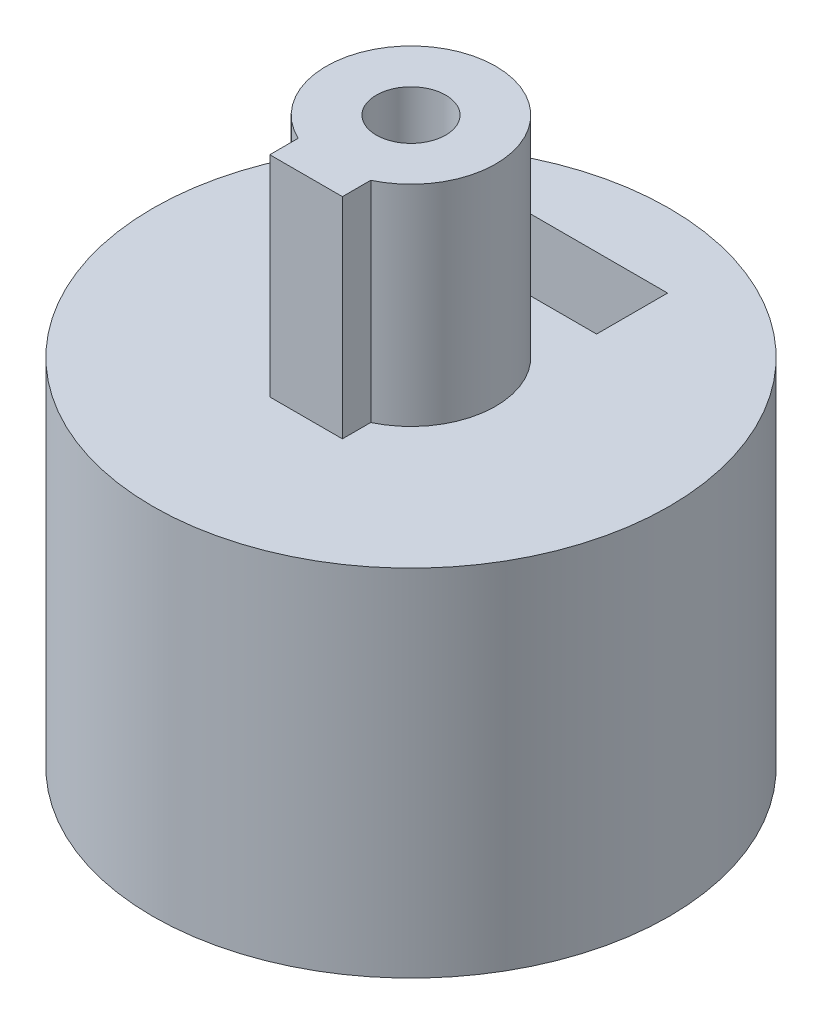
from build123d import *

# Parameters (mm, degrees)
SKETCH1_R           = 8
BOSS_EXTRUDE1_DEPTH = 10
SKETCH2_R           = 1.075
CUT_EXTRUDE1_DEPTH  = 16.099668871
SKETCH4_R           = 2.275
CUT_EXTRUDE4_DEPTH  = 16.099669052
SKETCH5_W           = 0.95
SKETCH5_H           = 7.069146706
BOSS_EXTRUDE2_DEPTH = 1.2
SKETCH7_R           = 8
BOSS_EXTRUDE3_DEPTH = 1
BOSS_EXTRUDE4_DEPTH = 6.5
SKETCH9_R           = 1.075
CUT_EXTRUDE5_DEPTH  = 6
CUT_EXTRUDE2_START  = -3.5
CUT_EXTRUDE2_DEPTH  = 2.2


with BuildPart() as part:
    # Sketch1 → Boss-Extrude1 (new body)
    with BuildSketch(Plane(origin=(0, 0, 0), x_dir=(1, 0, 0), z_dir=(0, 1, 0))):
        Circle(SKETCH1_R)
    extrude(amount=BOSS_EXTRUDE1_DEPTH)

    # Sketch2 → Cut-Extrude1 (cut, through all)
    with BuildSketch(Plane.XY):
        with Locations((0, 7)):
            Circle(SKETCH2_R)
    extrude(amount=-CUT_EXTRUDE1_DEPTH, mode=Mode.SUBTRACT)

    # Sketch4 → Cut-Extrude4 (cut, through all)
    with BuildSketch(Plane(origin=(0, 0, 0), x_dir=(1, 0, 0), z_dir=(0, 1, 0))):
        Circle(SKETCH4_R)
    extrude(amount=CUT_EXTRUDE4_DEPTH, mode=Mode.SUBTRACT)

    # Sketch5 → Boss-Extrude2 (add)
    with BuildSketch(Plane(origin=(0, 10, 0), x_dir=(1, 0, 0), z_dir=(0, 1, 0))):
        Rectangle(SKETCH5_W, SKETCH5_H)
    extrude(amount=-BOSS_EXTRUDE2_DEPTH)

    # Sketch7 → Boss-Extrude3 (add)
    with BuildSketch(Plane(origin=(0, 10, 0), x_dir=(1, 0, 0), z_dir=(0, 1, 0))):
        Circle(SKETCH7_R)
    extrude(amount=BOSS_EXTRUDE3_DEPTH)

    # Sketch8 → Boss-Extrude4 (add)
    with BuildSketch(Plane(origin=(0, 11, 0), x_dir=(1, 0, 0), z_dir=(0, 1, 0))):
        with BuildLine():
            Line((-1.125, -2.371708245), (-1.125, -3.25))
            Line((-1.125, -3.25), (1.125, -3.25))
            Line((1.125, -3.25), (1.125, -2.371708245))
            ThreePointArc((1.125, -2.371708245), (0, 2.625), (-1.125, -2.371708245))
        make_face()
    extrude(amount=BOSS_EXTRUDE4_DEPTH)

    # Sketch9 → Cut-Extrude5 (cut)
    with BuildSketch(Plane(origin=(0, 17.5, 0), x_dir=(1, 0, 0), z_dir=(0, 1, 0))):
        Circle(SKETCH9_R)
    extrude(amount=-CUT_EXTRUDE5_DEPTH, mode=Mode.SUBTRACT)

    # Sketch3 → Cut-Extrude2 (cut)
    with BuildSketch(Plane.XY.offset(CUT_EXTRUDE2_START)):
        Polygon((-2.25, 5.700961894), (0, 4.401923789), (2.25, 5.700961894), (2.25, 8.299038106), (2.25, 11.472802467), (-2.25, 11.472802467), (-2.25, 8.299038106), align=None)
    extrude(amount=-CUT_EXTRUDE2_DEPTH, mode=Mode.SUBTRACT)


solid = part.part
